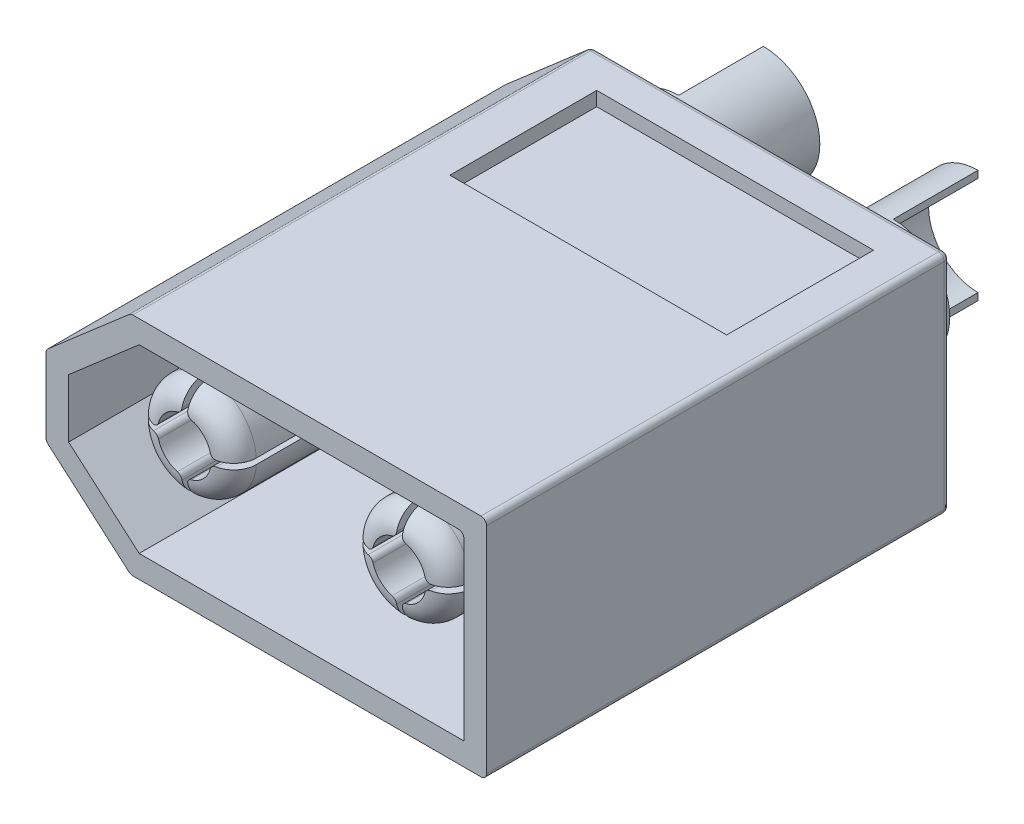
from build123d import *

# Parameters (mm, degrees)
BOSS_EXTRUDE10_DEPTH      = 16.4
SKETCH13_R                = 3
CUT_EXTRUDE3_DEPTH        = 4
SKETCH15_R                = 2
BOSS_EXTRUDE11_DEPTH      = 9
CUT_EXTRUDE5_DEPTH        = 2.999999997
CUT_EXTRUDE7_DEPTH        = 8.6
SKETCH22_R                = 2.25
CUT_EXTRUDE8_DEPTH        = 2
BOSS_EXTRUDE13_START      = 2
SKETCH24_R                = 2
BOSS_EXTRUDE13_DEPTH      = 2
BOSS_EXTRUDE18_DEPTH      = 7.7
FILLET73_R                = 0.2
FILLET85_R                = 0.799999999
CIRPATTERN1_COUNT         = 4
FILLET73_OF_CIRPATTERN1_R = 0.2
FILLET85_OF_CIRPATTERN1_R = 0.799999999
MIRROR3_OUTLINE_W         = 0.25
MIRROR3_OUTLINE_H         = 2
MIRROR3_START             = 7.8
MIRROR3_2_DEPTH           = 7.7
SKETCH34_W                = 2
SKETCH34_H                = 1
BOSS_EXTRUDE23_DEPTH      = 7
SKETCH35_W                = 1.1
SKETCH35_H                = 4
CUT_EXTRUDE10_DEPTH       = 1
SKETCH36_W                = 9.8
SKETCH36_H                = 5.199999998
CUT_EXTRUDE11_DEPTH       = 0.5
FILLET96_R                = 0.2
FILLET97_R                = 0.2
FILLET99_R                = 0.2


with BuildPart() as part:
    # Sketch12 → Boss-Extrude10 (new body)
    with BuildSketch(Plane.XY.offset(16.4)):
        Polygon((-7.8, 1.4), (-7.8, -1.4), (-4.8, -4), (7.8, -4), (7.8, 4), (-4.8, 4), align=None)
    extrude(amount=-BOSS_EXTRUDE10_DEPTH)

    # Sketch13 → Cut-Extrude3 (cut)
    with BuildSketch(Plane(origin=(0, 0, 0), x_dir=(-1, 0, 0), z_dir=(0, 0, -1))):
        with Locations(Location((3.8, 0, 0), (0, 0, 180))):
            Circle(SKETCH13_R)
        with Locations((-3.8, 0)):
            Circle(SKETCH13_R)
    extrude(amount=-CUT_EXTRUDE3_DEPTH, mode=Mode.SUBTRACT)

    # Sketch15 → Boss-Extrude11 (add)
    with BuildSketch(Plane(origin=(0, 0, 4), x_dir=(-1, 0, 0), z_dir=(0, 0, -1))):
        with Locations(Location((3.8, 0, 0), (0, 0, 180))):
            Circle(SKETCH15_R)
        with Locations(Location((-3.8, 0, 0), (0, 0, 180))):
            Circle(SKETCH15_R)
    extrude(amount=BOSS_EXTRUDE11_DEPTH)

    # Sketch17 → Cut-Revolve1 (revolve, cut)
    with BuildSketch(Plane(origin=(0, 0, 0), x_dir=(1, 0, 0), z_dir=(0, 1, 0))):
        Polygon((-2.05, 5), (-3.8, 5), (-3.8, 0.048493915), (-2.05, 1.100000001), align=None)
    cut_revolve1 = revolve(axis=Axis((-3.8, 0, -5.000025), (0, 0, 1)), mode=Mode.SUBTRACT)

    # Sketch19 → Cut-Extrude5 (cut)
    with BuildSketch(Plane(origin=(0, 0, -5), x_dir=(-1, 0, 0), z_dir=(0, 0, -1))):
        with BuildLine():
            Line((3.8, -1.75), (3.8, -2))
            ThreePointArc((3.8, -2), (5.8, 0), (3.8, 2))
            Line((3.8, 2), (3.8, 1.75))
            ThreePointArc((3.8, 1.75), (5.55, 0), (3.8, -1.75))
        make_face()
    cut_extrude5 = extrude(amount=-CUT_EXTRUDE5_DEPTH, mode=Mode.SUBTRACT)

    # Mirror2: Cut-Revolve1, Cut-Extrude5 across plane
    add(cut_revolve1.mirror(Plane(origin=(0, 0, 0), x_dir=(0, 0, 1), z_dir=(1, 0, 0))), mode=Mode.SUBTRACT)
    add(cut_extrude5.mirror(Plane(origin=(0, 0, 0), x_dir=(0, 0, 1), z_dir=(1, 0, 0))), mode=Mode.SUBTRACT)

    # Sketch21 → Cut-Extrude7 (cut)
    with BuildSketch(Plane.XY.offset(16.4)):
        Polygon((7, -3.2), (7, 3.2), (-4.501573339, 3.2), (-7, 1.034696894), (-7, -1.034696894), (-4.501573339, -3.2), align=None)
    extrude(amount=-CUT_EXTRUDE7_DEPTH, mode=Mode.SUBTRACT)

    # Sketch22 → Cut-Extrude8 (cut)
    with BuildSketch(Plane.XY.offset(7.8)):
        with Locations(Location((-3.8, 0, 0), (0, 0, 180))):
            Circle(SKETCH22_R)
    extrude(amount=-CUT_EXTRUDE8_DEPTH, mode=Mode.SUBTRACT)

    # Sketch24 → Boss-Extrude13 (add)
    with BuildSketch(Plane.XY.offset(5.8).offset(BOSS_EXTRUDE13_START)):
        with Locations((-3.8, 0)):
            Circle(SKETCH24_R)
    extrude(amount=-BOSS_EXTRUDE13_DEPTH)

    # Sketch29 → Boss-Extrude18 (add)
    with BuildSketch(Plane.XY.offset(7.8)):
        with BuildLine():
            Line((-3.7, -1.747140521), (-3.7, -0.944722181))
            ThreePointArc((-3.7, -0.944722181), (-3.128248558, -0.671751442), (-2.855277819, -0.1))
            Line((-2.855277819, -0.1), (-2.052859479, -0.1))
            ThreePointArc((-2.052859479, -0.1), (-2.562563133, -1.237436867), (-3.7, -1.747140521))
        make_face()
    boss_extrude18 = extrude(amount=BOSS_EXTRUDE18_DEPTH)

    # Fillet73
    fillet73_edges = [part.edges().sort_by_distance(p)[0] for p in [
        (-2.855277819, -0.1, 11.65),
        (-3.7, -0.944722181, 11.65),
    ]]
    fillet(fillet73_edges, radius=FILLET73_R)

    # Fillet85
    fillet85_edges = [part.edges().sort_by_distance(p)[0] for p in [
        (-2.562563133, -1.237436867, 15.5),
    ]]
    fillet(fillet85_edges, radius=FILLET85_R)

    # CirPattern1: Boss-Extrude18 ×4 about axis
    cirpattern1_axis = Axis((-3.8, 0, 0), (0, 0, 1))
    for i in range(1, CIRPATTERN1_COUNT):
        add(boss_extrude18.rotate(cirpattern1_axis, i * 360 / CIRPATTERN1_COUNT))

    # Fillet73 of CirPattern1
    fillet73_of_cirpattern1_edges = [part.edges().sort_by_distance(p)[0] for p in [
        (-3.7, 0.944722181, 11.65),
        (-2.855277819, 0.1, 11.65),
        (-4.744722181, 0.1, 11.65),
        (-3.9, 0.944722181, 11.65),
        (-3.9, -0.944722181, 11.65),
        (-4.744722181, -0.1, 11.65),
    ]]
    fillet(fillet73_of_cirpattern1_edges, radius=FILLET73_OF_CIRPATTERN1_R)

    # Fillet85 of CirPattern1
    fillet85_of_cirpattern1_edges = [part.edges().sort_by_distance(p)[0] for p in [
        (-2.562563133, 1.237436867, 15.5),
        (-5.037436867, 1.237436867, 15.5),
        (-5.037436867, -1.237436867, 15.5),
    ]]
    fillet(fillet85_of_cirpattern1_edges, radius=FILLET85_OF_CIRPATTERN1_R)

    # Mirror3: read off the stored shape, not the designer's step
    # Mirror3 outline → Mirror3 (revolve, cut)
    with BuildSketch(Plane(origin=(3.8, 0, 0), x_dir=(1, 0, 0), z_dir=(0, -1, 0))):
        with Locations((2.125, 6.8)):
            Rectangle(MIRROR3_OUTLINE_W, MIRROR3_OUTLINE_H)
    revolve(axis=Axis((3.8, 0, 0), (0, 0, 1)), mode=Mode.SUBTRACT)

    # Mirror3 2 outline → Mirror3 2 (add)
    with BuildSketch(Plane.XY.offset(MIRROR3_START)):
        with BuildLine():
            ThreePointArc((2.882894646, -0.247826087), (2.811403586, -0.141200153), (2.689819834, -0.1))
            Line((2.689819834, -0.1), (2.052859479, -0.1))
            ThreePointArc((2.052859479, -0.1), (2.562563133, -1.237436867), (3.7, -1.747140521))
            Line((3.7, -1.747140521), (3.7, -1.110180166))
            ThreePointArc((3.7, -1.110180166), (3.658799847, -0.988596414), (3.552173913, -0.917105354))
            ThreePointArc((3.552173913, -0.917105354), (3.128248558, -0.671751442), (2.882894646, -0.247826087))
        make_face()
        with BuildLine():
            ThreePointArc((3.9, -1.747140521), (5.037436867, -1.237436867), (5.547140521, -0.1))
            Line((5.547140521, -0.1), (4.910180166, -0.1))
            ThreePointArc((4.910180166, -0.1), (4.788596414, -0.141200153), (4.717105354, -0.247826087))
            ThreePointArc((4.717105354, -0.247826087), (4.471751442, -0.671751442), (4.047826087, -0.917105354))
            ThreePointArc((4.047826087, -0.917105354), (3.941200153, -0.988596414), (3.9, -1.110180166))
            Line((3.9, -1.110180166), (3.9, -1.747140521))
        make_face()
        with BuildLine():
            ThreePointArc((3.7, 1.747140521), (2.562563133, 1.237436867), (2.052859479, 0.1))
            Line((2.052859479, 0.1), (2.689819834, 0.1))
            ThreePointArc((2.689819834, 0.1), (2.811403586, 0.141200153), (2.882894646, 0.247826087))
            ThreePointArc((2.882894646, 0.247826087), (3.128248558, 0.671751442), (3.552173913, 0.917105354))
            ThreePointArc((3.552173913, 0.917105354), (3.658799847, 0.988596414), (3.7, 1.110180166))
            Line((3.7, 1.110180166), (3.7, 1.747140521))
        make_face()
        with BuildLine():
            ThreePointArc((4.717105354, 0.247826087), (4.788596414, 0.141200153), (4.910180166, 0.1))
            Line((4.910180166, 0.1), (5.547140521, 0.1))
            ThreePointArc((5.547140521, 0.1), (5.037436867, 1.237436867), (3.9, 1.747140521))
            Line((3.9, 1.747140521), (3.9, 1.110180166))
            ThreePointArc((3.9, 1.110180166), (3.941200153, 0.988596414), (4.047826087, 0.917105354))
            ThreePointArc((4.047826087, 0.917105354), (4.471751442, 0.671751442), (4.717105354, 0.247826087))
        make_face()
    extrude(amount=MIRROR3_2_DEPTH)

    # Mirror3 3 outline → Mirror3 3 (revolve, cut)
    with BuildSketch(Plane(origin=(3.8, 0, 0), x_dir=(1, 0, 0), z_dir=(0, -1, 0))):
        with BuildLine():
            Line((1.75, 15.5), (0.949998297, 15.5))
            ThreePointArc((0.949998297, 15.5), (1.515684823, 15.265686028), (1.75, 14.700000001))
            Line((1.75, 14.700000001), (1.75, 15.5))
        make_face()
    revolve(axis=Axis((3.8, 0, 0), (0, 0, 1)), mode=Mode.SUBTRACT)

    # Sketch34 → Boss-Extrude23 (add)
    with BuildSketch(Plane.XY.offset(7.8)):
        with Locations((0, 2.7)):
            Rectangle(SKETCH34_W, SKETCH34_H)
    extrude(amount=BOSS_EXTRUDE23_DEPTH)

    # Sketch35 → Cut-Extrude10 (cut)
    with BuildSketch(Plane.XY.offset(7.8)):
        Rectangle(SKETCH35_W, SKETCH35_H)
    extrude(amount=-CUT_EXTRUDE10_DEPTH, mode=Mode.SUBTRACT)

    # Sketch36 → Cut-Extrude11 (cut)
    with BuildSketch(Plane(origin=(0, 4, 0), x_dir=(1, 0, 0), z_dir=(0, 1, 0))):
        with Locations((1.500000001, -3.900000001)):
            Rectangle(SKETCH36_W, SKETCH36_H)
    cut_extrude11 = extrude(amount=-CUT_EXTRUDE11_DEPTH, mode=Mode.SUBTRACT)

    # Mirror1: Cut-Extrude11 across plane
    add(cut_extrude11.mirror(Plane.ZX), mode=Mode.SUBTRACT)

    # Fillet96
    fillet96_edges = [part.edges().sort_by_distance(p)[0] for p in [
        (7, 3.2, 12.1),
    ]]
    fillet(fillet96_edges, radius=FILLET96_R)

    # Fillet97
    fillet97_edges = [part.edges().sort_by_distance(p)[0] for p in [
        (-1, 2.2, 11.3),
        (1, 2.2, 11.3),
        (-1, 2.7, 14.8),
        (0, 2.2, 14.8),
        (1, 2.7, 14.8),
    ]]
    fillet(fillet97_edges, radius=FILLET97_R)

    # Fillet99
    fillet99_edges = [part.edges().sort_by_distance(p)[0] for p in [
        (-6.3, -2.7, 0),
        (-4.8, 4, 8.2),
        (7.8, 4, 8.2),
        (7.8, -4, 8.2),
        (-4.8, -4, 8.2),
        (-7.8, -1.4, 8.2),
        (-7.8, 1.4, 8.2),
        (1.5, -4, 0),
        (7.8, 0, 0),
        (1.5, 4, 0),
        (-6.3, 2.7, 0),
        (-7.8, 0, 0),
    ]]
    fillet(fillet99_edges, radius=FILLET99_R)


solid = part.part
